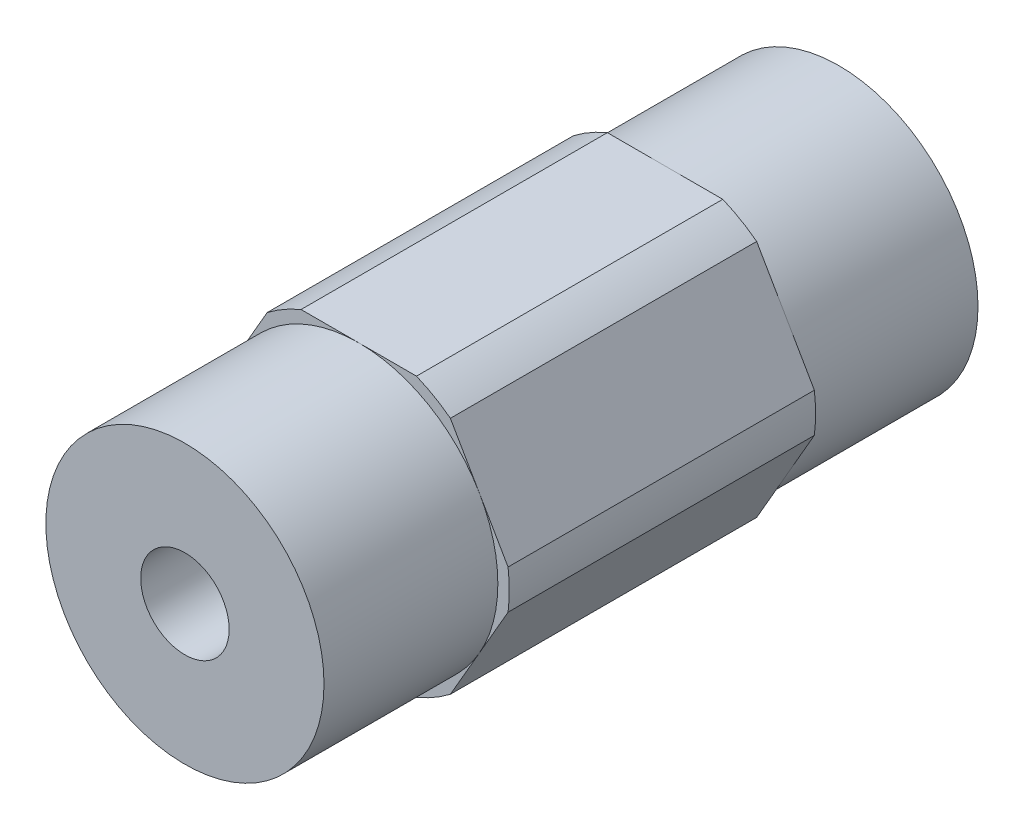
from build123d import *

# Parameters (mm, degrees)
SKETCH1_R                            = 2.0193
BOSS_EXTRUDE1_DEPTH                  = 14.93012
F_10_32_TAPPED_HOLE1_D               = 4.0386
F_10_32_TAPPED_HOLE1_DEPTH           = 11.938
F_10_32_TAPPED_HOLE1_TIP             = 1.213317848
F_10_32_TAPPED_HOLE1_ON_FACE_2_D     = 4.0386
F_10_32_TAPPED_HOLE1_ON_FACE_2_DEPTH = 11.938
F_10_32_TAPPED_HOLE1_ON_FACE_2_TIP   = 1.213317848
SKETCH4_R                            = 8.89
SKETCH4_R_2                          = 6.35
CUT_EXTRUDE_THIN1_DEPTH              = 7.9375


with BuildPart() as part:
    # Sketch1 → Boss-Extrude1 (new, symmetric)
    with BuildSketch(Plane.XY):
        with BuildLine():
            ThreePointArc((6.874999966, 0), (6.860422465, 0.447468582), (6.816751782, 0.893039571))
            Line((6.816751782, 0.893039571), (4.181770846, 5.456960429))
            ThreePointArc((4.181770846, 5.456960429), (3.437499983, 5.953924622), (2.634980936, 6.35))
            Line((2.634980936, 6.35), (-2.634980936, 6.35))
            ThreePointArc((-2.634980936, 6.35), (-3.437499983, 5.953924622), (-4.181770846, 5.456960429))
            Line((-4.181770846, 5.456960429), (-6.816751782, 0.893039571))
            ThreePointArc((-6.816751782, 0.893039571), (-6.874999966, 0), (-6.816751782, -0.893039571))
            Line((-6.816751782, -0.893039571), (-4.181770846, -5.456960429))
            ThreePointArc((-4.181770846, -5.456960429), (-3.437499983, -5.953924622), (-2.634980936, -6.35))
            Line((-2.634980936, -6.35), (2.634980936, -6.35))
            ThreePointArc((2.634980936, -6.35), (3.437499983, -5.953924622), (4.181770846, -5.456960429))
            Line((4.181770846, -5.456960429), (6.816751782, -0.893039571))
            ThreePointArc((6.816751782, -0.893039571), (6.860422465, -0.447468582), (6.874999966, 0))
        make_face()
        Circle(SKETCH1_R, mode=Mode.SUBTRACT)
    extrude(amount=BOSS_EXTRUDE1_DEPTH, both=True)

    # #10-32 Tapped Hole1
    with Locations(Plane.XY.offset(14.93012)):
        with Locations((0, 0)):
            Hole(F_10_32_TAPPED_HOLE1_D / 2, depth=F_10_32_TAPPED_HOLE1_DEPTH)
            with Locations((0, 0, -(F_10_32_TAPPED_HOLE1_DEPTH + F_10_32_TAPPED_HOLE1_TIP / 2))):  # 118° drill point
                Cone(0, F_10_32_TAPPED_HOLE1_D / 2, F_10_32_TAPPED_HOLE1_TIP, mode=Mode.SUBTRACT)

    # #10-32 Tapped Hole1 on face 2
    with Locations(Plane.XY.offset(-14.93012)):
        with Locations((0, 0)):
            Hole(F_10_32_TAPPED_HOLE1_ON_FACE_2_D / 2, depth=F_10_32_TAPPED_HOLE1_ON_FACE_2_DEPTH)
            with Locations((0, 0, -(F_10_32_TAPPED_HOLE1_ON_FACE_2_DEPTH + F_10_32_TAPPED_HOLE1_ON_FACE_2_TIP / 2))):  # 118° drill point
                Cone(0, F_10_32_TAPPED_HOLE1_ON_FACE_2_D / 2, F_10_32_TAPPED_HOLE1_ON_FACE_2_TIP, mode=Mode.SUBTRACT)

    # Sketch4 → Cut-Extrude-Thin1 (cut)
    with BuildSketch(Plane.XY.offset(14.93012)):
        Circle(SKETCH4_R)
        Circle(SKETCH4_R_2, mode=Mode.SUBTRACT)
    cut_extrude_thin1 = extrude(amount=-CUT_EXTRUDE_THIN1_DEPTH, mode=Mode.SUBTRACT)

    # Mirror1: Cut-Extrude-Thin1 across plane
    add(cut_extrude_thin1.mirror(Plane.XY), mode=Mode.SUBTRACT)


solid = part.part
